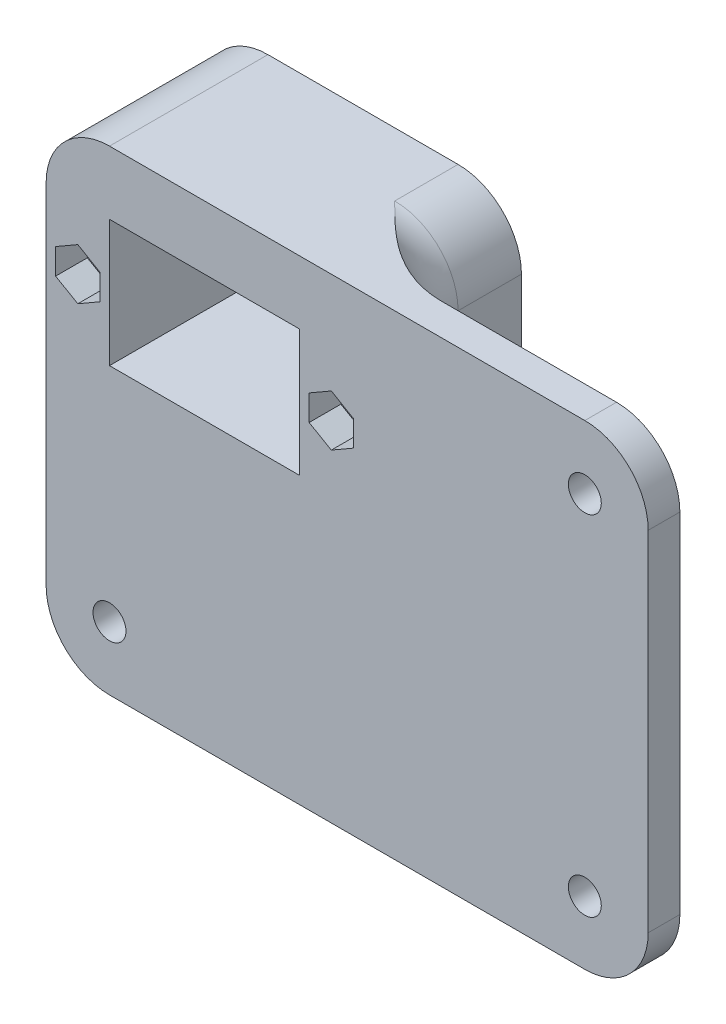
from build123d import *

# Parameters (mm, degrees)
SKETCH_1_W               = 95
SKETCH_1_H               = 75
SKETCH_1_W_2             = 30
SKETCH_1_H_2             = 20
EXTRUDE_1_DEPTH          = 5
EXTRUDE_START            = -5
SKETCH_2_W               = 50
SKETCH_2_H               = 40
SKETCH_2_W_2             = 30
SKETCH_2_H_2             = 20
EXTRUDE_2_DEPTH          = 20
CUT_EXTRUDE_1_DEPTH      = 93.466210045
CUT_EXTRUDE_1_DEPTH_BACK = 93.466210045
SKETCH_3_R               = 2.2
CUT_EXTRUDE_2_DEPTH      = 5
SKETCH_5_R               = 2.6
CUT_EXTRUDE_3_DEPTH      = 93.466210045
FILLET_4_R               = 10
FILLET_5_R               = 10


with BuildPart() as part:
    # 草图1 → 凸台-拉伸1 (new body)
    with BuildSketch(Plane.XY):
        with Locations((22.5, -17.5)):
            Rectangle(SKETCH_1_W, SKETCH_1_H)
        Rectangle(SKETCH_1_W_2, SKETCH_1_H_2, mode=Mode.SUBTRACT)
    extrude(amount=EXTRUDE_1_DEPTH)

    # 草图2 → 凸台-拉伸2 (add)
    with BuildSketch(Plane.XY.offset(5).offset(EXTRUDE_START)):
        Rectangle(SKETCH_2_W, SKETCH_2_H)
        Rectangle(SKETCH_2_W_2, SKETCH_2_H_2, mode=Mode.SUBTRACT)
    extrude(amount=-EXTRUDE_2_DEPTH)

    # 草图3 → 切除-拉伸1 (cut, two sides: drawn at the far end of the back side and taken through both)
    with BuildSketch(Plane(origin=(0, 0, -20), x_dir=(-1, 0, 0), z_dir=(0, 0, -1)).offset(-CUT_EXTRUDE_1_DEPTH_BACK)):
        with Locations((20, 0)):
            Circle(SKETCH_3_R)
        with Locations((-20, 0)):
            Circle(SKETCH_3_R)
    extrude(amount=CUT_EXTRUDE_1_DEPTH + CUT_EXTRUDE_1_DEPTH_BACK, mode=Mode.SUBTRACT)

    # 草图4 → 切除-拉伸2 (cut)
    with BuildSketch(Plane(origin=(0, 0, 0), x_dir=(-1, 0, 0), z_dir=(0, 0, -1))):
        Polygon((20, 4.041451884), (16.5, 2.020725942), (16.5, -2.020725942), (20, -4.041451884), (23.5, -2.020725942), (23.5, 2.020725942), align=None)
        Polygon((-20, 4.041451884), (-23.5, 2.020725942), (-23.5, -2.020725942), (-20, -4.041451884), (-16.5, -2.020725942), (-16.5, 2.020725942), align=None)
    extrude(amount=-CUT_EXTRUDE_2_DEPTH, mode=Mode.SUBTRACT)

    # 草图5 → 切除-拉伸3 (cut, through all)
    with BuildSketch(Plane.XY.offset(5)):
        with Locations((60, -45)):
            Circle(SKETCH_5_R)
        with Locations((-15, -45)):
            Circle(SKETCH_5_R)
        with Locations((60, 10)):
            Circle(SKETCH_5_R)
    extrude(amount=-CUT_EXTRUDE_3_DEPTH, mode=Mode.SUBTRACT)

    # 圆角4
    fillet_4_edges = [part.edges().sort_by_distance(p)[0] for p in [
        (25, 20, -10),
        (25, -20, -10),
        (-25, -20, -10),
        (-25, 20, -7.5),
        (70, 20, 2.5),
        (70, -55, 2.5),
        (-25, -55, 2.5),
    ]]
    fillet(fillet_4_edges, radius=FILLET_4_R)

    # 圆角5
    # the kernel refuses this fillet: 10 mm, written as the material it adds along each edge
    with BuildSketch(Plane(origin=(15, -20, 0), x_dir=(0, 0, -1), z_dir=(-1, 0, 0))) as fillet_5_piece_1:
        with BuildLine():
            CenterArc((FILLET_5_R, FILLET_5_R), FILLET_5_R, 180, 90)
            Line((0, FILLET_5_R), (0, 0))
            Line((0, 0), (FILLET_5_R, 0))
        make_face()
    extrude(amount=30)
    with BuildSketch(Plane(origin=(25, 10, 0), x_dir=(0, 0, -1), z_dir=(0, -1, 0))) as fillet_5_piece_2:
        with BuildLine():
            CenterArc((FILLET_5_R, FILLET_5_R), FILLET_5_R, 180, 90)
            Line((0, FILLET_5_R), (0, 0))
            Line((0, 0), (FILLET_5_R, 0))
        make_face()
    extrude(amount=20)
    with BuildSketch(Plane(origin=(-15, -10, 0), x_dir=(0.801744239297648, 0.5976672776328277, 0), z_dir=(0.5976672776328277, -0.801744239297648, 0))) as fillet_5_piece_3_section:
        with BuildLine():
            CenterArc((10 + FILLET_5_R, -FILLET_5_R), FILLET_5_R, 90, 90)
            Line((10 + FILLET_5_R, 0), (10, 0))
            Line((10, 0), (10, -FILLET_5_R))
        make_face()
    fillet_5_piece_3 = revolve(axis=Axis((-15, -10, 0), (0, 0, 1)), revolution_arc=233.296989237, mode=Mode.PRIVATE)
    fillet_5_piece_3 = split(fillet_5_piece_3, bisect_by=Plane(origin=(-25, -15.925458523, -2.890503096), z_dir=(1, 0, 0)), keep=Keep.TOP, mode=Mode.PRIVATE)
    fillet_5_piece_3 = split(fillet_5_piece_3, bisect_by=Plane(origin=(-18.102265681, -5.137109304, -2.890503096), z_dir=(-0.4999999999999994, -0.866025403784439, 0)), keep=Keep.TOP, mode=Mode.PRIVATE)
    add(fillet_5_piece_3)
    with BuildSketch(Plane(origin=(15, -10, 0), x_dir=(1, 0, 0), z_dir=(0, 1, 0))) as fillet_5_piece_4:
        with BuildLine():
            CenterArc((10 + FILLET_5_R, FILLET_5_R), FILLET_5_R, 180, 90)
            Line((10 + FILLET_5_R, 0), (10, 0))
            Line((10, 0), (10, FILLET_5_R))
        make_face()
    revolve(axis=Axis((15, -10, 0), (0, 0, -1)), revolution_arc=90)
    with BuildSketch(Plane(origin=(15, 10, 0), x_dir=(-0.597667277632828, -0.8017442392976479, 0), z_dir=(0.8017442392976479, -0.597667277632828, 0))) as fillet_5_piece_5_section:
        with BuildLine():
            CenterArc((10 + FILLET_5_R, FILLET_5_R), FILLET_5_R, 180, 90)
            Line((10 + FILLET_5_R, 0), (10, 0))
            Line((10, 0), (10, FILLET_5_R))
        make_face()
    fillet_5_piece_5 = revolve(axis=Axis((15, 10, 0), (0, 0, -1)), revolution_arc=233.296989237, mode=Mode.PRIVATE)
    fillet_5_piece_5 = split(fillet_5_piece_5, bisect_by=Plane(origin=(22.499389328, 20, -3.116283122), z_dir=(0, -1, 0)), keep=Keep.TOP, mode=Mode.PRIVATE)
    fillet_5_piece_5 = split(fillet_5_piece_5, bisect_by=Plane(origin=(22.499389328, 10, -3.116283122), z_dir=(0, 1, 0)), keep=Keep.TOP, mode=Mode.PRIVATE)
    add(fillet_5_piece_5)


solid = part.part
